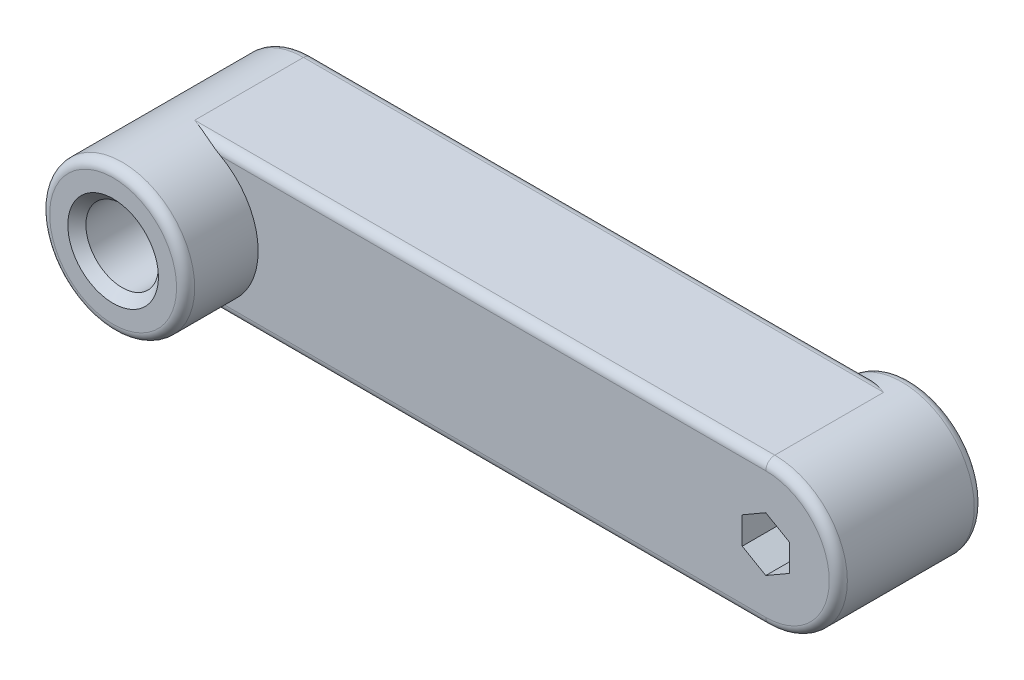
from build123d import *

# Parameters (mm, degrees)
ESBO_O1_R                = 2
RESSALTO_EXTRUS_O1_DEPTH = 12
ESBO_O2_OUTSIDE_W        = 50.504
ESBO_O2_OUTSIDE_H        = 18.504
ESBO_O2_OUTSIDE_R        = 4
CORTE_EXTRUS_O1_DEPTH    = 1
ESBO_O3_OUTSIDE_W        = 50.504
ESBO_O3_OUTSIDE_H        = 18.504
ESBO_O3_OUTSIDE_R        = 4
CORTE_EXTRUS_O2_DEPTH    = 4
FILETE1_R                = 0.5
CHANFRO1_SIZE            = 0.5


with BuildPart() as part:
    # Esboço1 → Ressalto-extrusão1 (new body)
    with BuildSketch(Plane.XY):
        with BuildLine():
            Line((0, -4), (-32, -4))
            ThreePointArc((-32, -4), (-36, 0), (-32, 4))
            Line((-32, 4), (0, 4))
            ThreePointArc((0, 4), (4, 0), (0, -4))
        make_face()
        with Locations((-32, 0)):
            Circle(ESBO_O1_R, mode=Mode.SUBTRACT)
        Polygon((0, 1.500013734), (-1.29905, 0.750006867), (-1.29905, -0.750006867), (0, -1.500013734), (1.29905, -0.750006867), (1.29905, 0.750006867), align=None, mode=Mode.SUBTRACT)
    extrude(amount=RESSALTO_EXTRUS_O1_DEPTH)

    # Esboço2 outside → Corte-extrusão1 (cut)
    with BuildSketch(Plane(origin=(0, 0, 0), x_dir=(-1, 0, 0), z_dir=(0, 0, -1))):
        with Locations((16, 0)):
            Rectangle(ESBO_O2_OUTSIDE_W, ESBO_O2_OUTSIDE_H)
        with Locations(Location((0, 0, 0), (0, 0, 90))):
            Circle(ESBO_O2_OUTSIDE_R, mode=Mode.SUBTRACT)
    extrude(amount=-CORTE_EXTRUS_O1_DEPTH, mode=Mode.SUBTRACT)

    # Esboço3 outside → Corte-extrusão2 (cut)
    with BuildSketch(Plane.XY.offset(12)):
        with Locations((-16, 0)):
            Rectangle(ESBO_O3_OUTSIDE_W, ESBO_O3_OUTSIDE_H)
        with Locations(Location((-32, 0, 0), (0, 0, 90))):
            Circle(ESBO_O3_OUTSIDE_R, mode=Mode.SUBTRACT)
    extrude(amount=-CORTE_EXTRUS_O2_DEPTH, mode=Mode.SUBTRACT)

    # Filete1
    # the kernel refuses this fillet: 0.5 mm, written as the material it takes off along each edge
    with BuildSketch(Plane(origin=(-32, 0, 12), x_dir=(0, -1, 0), z_dir=(1, 0, 0))) as filete1_piece_1:
        with BuildLine():
            CenterArc((4 - FILETE1_R, FILETE1_R), FILETE1_R, 270, 90)
            Line((4, FILETE1_R), (4, 0))
            Line((4, 0), (4 - FILETE1_R, 0))
        make_face()
    revolve(axis=Axis((-32, 0, 12), (0, 0, -1)), mode=Mode.SUBTRACT)
    with BuildSketch(Plane(origin=(-32, 0, 1), x_dir=(0, -1, 0), z_dir=(1, 0, 0))) as filete1_piece_2:
        with BuildLine():
            CenterArc((4 - FILETE1_R, -FILETE1_R), FILETE1_R, 0, 90)
            Line((4, -FILETE1_R), (4, 0))
            Line((4, 0), (4 - FILETE1_R, 0))
        make_face()
    revolve(axis=Axis((-32, 0, 1), (0, 0, -1)), revolution_arc=180, mode=Mode.SUBTRACT)
    with BuildSketch(Plane(origin=(1.25, 4, 1), x_dir=(0, -1, 0), z_dir=(-1, 0, 0))) as filete1_piece_3_section:
        with BuildLine():
            CenterArc((FILETE1_R, FILETE1_R), FILETE1_R, 180, 90)
            Line((0, FILETE1_R), (0, 0))
            Line((0, 0), (FILETE1_R, 0))
        make_face()
    filete1_piece_3 = extrude(amount=33.25, mode=Mode.PRIVATE)
    filete1_piece_3 = filete1_piece_3 - Plane(origin=(0, 0, 1.115122713), x_dir=(0, 1, 0), z_dir=(0, 0, -1)) * Cylinder(4, 69, mode=Mode.PRIVATE)
    add(filete1_piece_3, mode=Mode.SUBTRACT)
    with BuildSketch(Plane(origin=(-32, -4, 1), x_dir=(0, 0, 1), z_dir=(1, 0, 0))) as filete1_piece_4_section:
        with BuildLine():
            CenterArc((FILETE1_R, -FILETE1_R), FILETE1_R, 90, 90)
            Line((0, -FILETE1_R), (0, 0))
            Line((0, 0), (FILETE1_R, 0))
        make_face()
    filete1_piece_4 = extrude(amount=33.25, mode=Mode.PRIVATE)
    filete1_piece_4 = filete1_piece_4 - Plane(origin=(0, 0, 1.115122438), x_dir=(0, 1, 0), z_dir=(0, 0, -1)) * Cylinder(4, 69, mode=Mode.PRIVATE)
    add(filete1_piece_4, mode=Mode.SUBTRACT)
    with BuildSketch(Plane(origin=(0, 0, 0), x_dir=(0, 1, 0), z_dir=(1, 0, 0))) as filete1_piece_5:
        with BuildLine():
            CenterArc((4 - FILETE1_R, FILETE1_R), FILETE1_R, 270, 90)
            Line((4 - FILETE1_R, 0), (4, 0))
            Line((4, 0), (4, FILETE1_R))
        make_face()
    revolve(axis=Axis((0, 0, 0), (0, 0, 1)), mode=Mode.SUBTRACT)
    with BuildSketch(Plane(origin=(0, 0, 8), x_dir=(0, 1, 0), z_dir=(-1, 0, 0))) as filete1_piece_6:
        with BuildLine():
            CenterArc((4 - FILETE1_R, FILETE1_R), FILETE1_R, 270, 90)
            Line((4 - FILETE1_R, 0), (4, 0))
            Line((4, 0), (4, FILETE1_R))
        make_face()
    revolve(axis=Axis((0, 0, 8), (0, 0, -1)), revolution_arc=180, mode=Mode.SUBTRACT)
    with BuildSketch(Plane(origin=(-33.25, 4, 8), x_dir=(0, 0, -1), z_dir=(1, 0, 0))) as filete1_piece_7_section:
        with BuildLine():
            CenterArc((FILETE1_R, -FILETE1_R), FILETE1_R, 90, 90)
            Line((0, -FILETE1_R), (0, 0))
            Line((0, 0), (FILETE1_R, 0))
        make_face()
    filete1_piece_7 = extrude(amount=33.25, mode=Mode.PRIVATE)
    filete1_piece_7 = filete1_piece_7 - Plane(origin=(-32, 0, 7.884877562), x_dir=(0, -1, 0), z_dir=(0, 0, -1)) * Cylinder(4, 69, mode=Mode.PRIVATE)
    add(filete1_piece_7, mode=Mode.SUBTRACT)
    with BuildSketch(Plane(origin=(0, -4, 8), x_dir=(0, 0, -1), z_dir=(-1, 0, 0))) as filete1_piece_8_section:
        with BuildLine():
            CenterArc((FILETE1_R, -FILETE1_R), FILETE1_R, 90, 90)
            Line((0, -FILETE1_R), (0, 0))
            Line((0, 0), (FILETE1_R, 0))
        make_face()
    filete1_piece_8 = extrude(amount=33.25, mode=Mode.PRIVATE)
    filete1_piece_8 = filete1_piece_8 - Plane(origin=(-32, 0, 7.884877562), x_dir=(0, -1, 0), z_dir=(0, 0, -1)) * Cylinder(4, 69, mode=Mode.PRIVATE)
    add(filete1_piece_8, mode=Mode.SUBTRACT)

    # Chanfro1
    chanfro1_edges = [part.edges().sort_by_distance(p)[0] for p in [
        (-34, 0, 12),
        (-34, 0, 1),
    ]]
    chamfer(chanfro1_edges, length=CHANFRO1_SIZE)


solid = part.part
